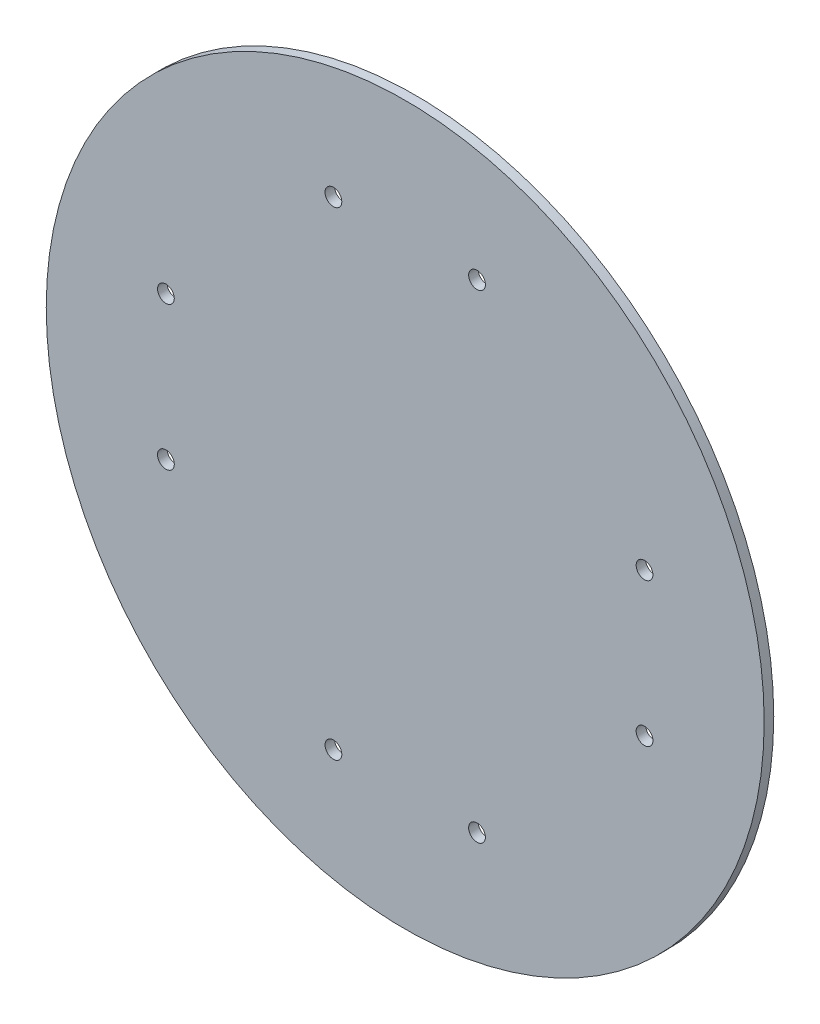
from build123d import *

# Parameters (mm, degrees)
SKETCH1_R           = 75
BOSS_EXTRUDE1_DEPTH = 2
SKETCH2_R           = 1.75
CUT_EXTRUDE1_DEPTH  = 107.084871683


with BuildPart() as part:
    # Sketch1 → Boss-Extrude1 (new body)
    with BuildSketch(Plane.XY):
        Circle(SKETCH1_R)
    extrude(amount=BOSS_EXTRUDE1_DEPTH)

    # Sketch2 → Cut-Extrude1 (cut, through all)
    with BuildSketch(Plane(origin=(0, 0, 0), x_dir=(-1, 0, 0), z_dir=(0, 0, -1))):
        with Locations((-50, 15)):
            Circle(SKETCH2_R)
        with Locations((-50, -15)):
            Circle(SKETCH2_R)
        with Locations((-15, -50)):
            Circle(SKETCH2_R)
        with Locations((15, -50)):
            Circle(SKETCH2_R)
        with Locations((50, -15)):
            Circle(SKETCH2_R)
        with Locations((50, 15)):
            Circle(SKETCH2_R)
        with Locations((-15, 50)):
            Circle(SKETCH2_R)
        with Locations((15, 50)):
            Circle(SKETCH2_R)
    extrude(amount=-CUT_EXTRUDE1_DEPTH, mode=Mode.SUBTRACT)


solid = part.part
